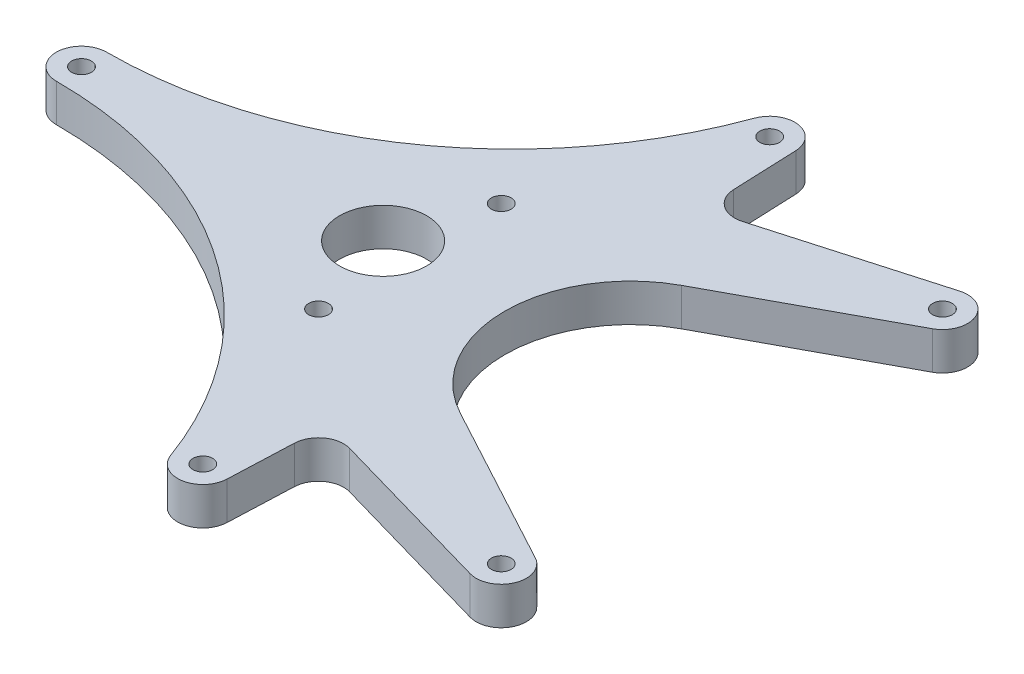
from build123d import *

# Parameters (mm, degrees)
SKETCH2_R           = 11
SKETCH2_R_2         = 2.4892
BOSS_EXTRUDE1_DEPTH = 4.7625


with BuildPart() as part:
    # Sketch2 → Boss-Extrude1 (new, symmetric)
    with BuildSketch(Plane(origin=(0, 0, 0), x_dir=(1, 0, 0), z_dir=(0, 1, 0))):
        with BuildLine():
            Line((33.069815171, 55.476270205), (32.406741693, 71.861340297))
            ThreePointArc((32.406741693, 71.861340297), (27.037918624, 77.87912596), (20.094886779, 73.776405614))
            ThreePointArc((20.094886779, 73.776405614), (-17.422824596, 24.882372219), (-76.2, 6.35))
            ThreePointArc((-76.2, 6.35), (-82.55, 0), (-76.2, -6.35))
            ThreePointArc((-76.2, -6.35), (-17.422824596, -24.882372219), (20.094886779, -73.776405614))
            ThreePointArc((20.094886779, -73.776405614), (27.037918624, -77.87912596), (32.406741693, -71.861340297))
            Line((32.406741693, -71.861340297), (33.069815171, -55.476270205))
            ThreePointArc((33.069815171, -55.476270205), (35.69489898, -50.586562058), (41.161290327, -49.627981648))
            Line((41.161290327, -49.627981648), (83.838709673, -61.83808395))
            ThreePointArc((83.838709673, -61.83808395), (91.466763895, -58.127150721), (88.599086108, -50.143751648))
            Line((88.599086108, -50.143751648), (47.431459746, -27.946405755))
            ThreePointArc((47.431459746, -27.946405755), (30.75, 0), (47.431459746, 27.946405755))
            Line((47.431459746, 27.946405755), (88.599086108, 50.143751648))
            ThreePointArc((88.599086108, 50.143751648), (91.466763895, 58.127150721), (83.838709673, 61.83808395))
            Line((83.838709673, 61.83808395), (41.161290327, 49.627981648))
            ThreePointArc((41.161290327, 49.627981648), (35.69489898, 50.586562058), (33.069815171, 55.476270205))
        make_face()
        Circle(SKETCH2_R, mode=Mode.SUBTRACT)
        with Locations((85.585378057, 55.733032799)):
            Circle(SKETCH2_R_2, mode=Mode.SUBTRACT)
        with Locations((85.585378057, -55.733032799)):
            Circle(SKETCH2_R_2, mode=Mode.SUBTRACT)
        with Locations((26.061934921, -71.604577704)):
            Circle(SKETCH2_R_2, mode=Mode.SUBTRACT)
        with Locations((-76.2, 0)):
            Circle(SKETCH2_R_2, mode=Mode.SUBTRACT)
        with Locations((26.061934921, 71.604577704)):
            Circle(SKETCH2_R_2, mode=Mode.SUBTRACT)
        with Locations((6.766967201, -23.085378057)):
            Circle(SKETCH2_R_2, mode=Mode.SUBTRACT)
        with Locations((6.766967201, 23.085378057)):
            Circle(SKETCH2_R_2, mode=Mode.SUBTRACT)
    extrude(amount=BOSS_EXTRUDE1_DEPTH, both=True)


solid = part.part
